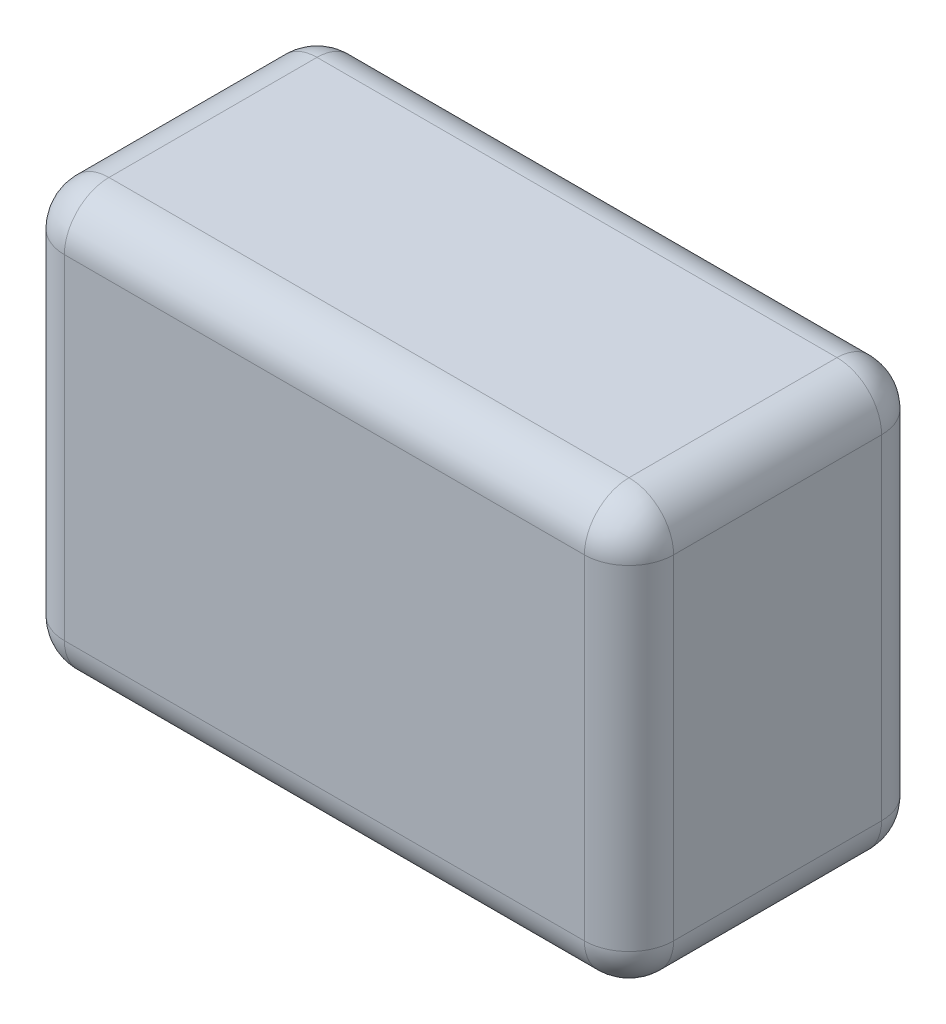
from build123d import *

# Parameters (mm, degrees)
SKETCH1_W           = 82
SKETCH1_H           = 40
BOSS_EXTRUDE1_DEPTH = 57
FILLET1_R           = 6


with BuildPart() as part:
    # Sketch1 → Boss-Extrude1 (new body)
    with BuildSketch(Plane(origin=(0, 0, 0), x_dir=(1, 0, 0), z_dir=(0, 1, 0))):
        with Locations((41, -20)):
            Rectangle(SKETCH1_W, SKETCH1_H)
    extrude(amount=BOSS_EXTRUDE1_DEPTH)

    # Fillet1
    fillet1_edges = [part.edges().sort_by_distance(p)[0] for p in [
        (0, 28.5, 40),
        (82, 28.5, 40),
        (82, 28.5, 0),
        (0, 28.5, 0),
        (41, 57, 0),
        (82, 57, 20),
        (41, 57, 40),
        (0, 57, 20),
        (41, 0, 0),
        (82, 0, 20),
        (41, 0, 40),
        (0, 0, 20),
    ]]
    fillet(fillet1_edges, radius=FILLET1_R)


solid = part.part
